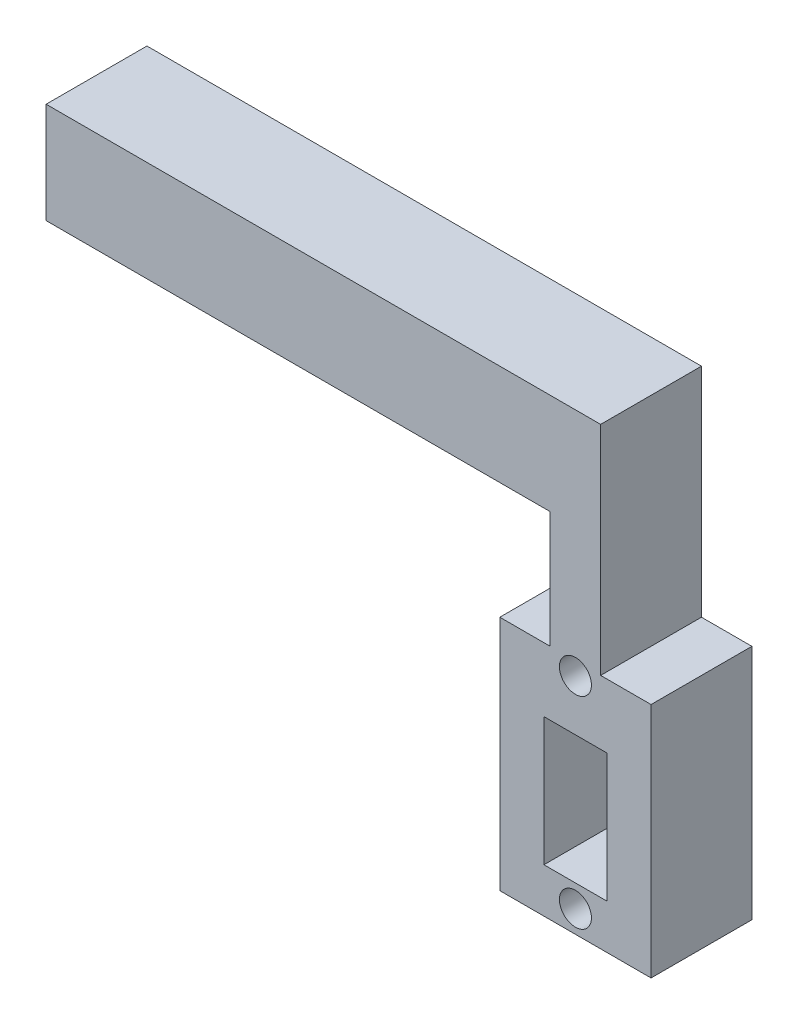
from build123d import *

# Parameters (mm, degrees)
SKETCH1_R           = 3.175
SKETCH1_W           = 12.5
SKETCH1_H           = 25.448258842
BOSS_EXTRUDE1_DEPTH = 20
SKETCH3_R           = 2.5
CUT_EXTRUDE2_DEPTH  = 10


with BuildPart() as part:
    # Sketch1 → Boss-Extrude1 (new body)
    with BuildSketch(Plane.XY):
        Polygon((55, -10), (55, 10), (-55, 10), (-55, -10), (45, -10), (45, -33.128046601), (35, -33.128046601), (35, -80.10944754), (65, -80.10944754), (65, -33.128046601), (55, -33.128046601), align=None)
        with Locations((50, -35.707848061)):
            Circle(SKETCH1_R, mode=Mode.SUBTRACT)
        with Locations((50, -75.707848061)):
            Circle(SKETCH1_R, mode=Mode.SUBTRACT)
        with Locations((50, -58.554564532)):
            Rectangle(SKETCH1_W, SKETCH1_H, mode=Mode.SUBTRACT)
    extrude(amount=BOSS_EXTRUDE1_DEPTH)

    # Sketch3 → Cut-Extrude2 (cut)
    with BuildSketch(Plane.XZ.offset(45.830435111)):
        with Locations((50, 10)):
            Circle(SKETCH3_R)
    extrude(amount=-CUT_EXTRUDE2_DEPTH, mode=Mode.SUBTRACT)


solid = part.part
